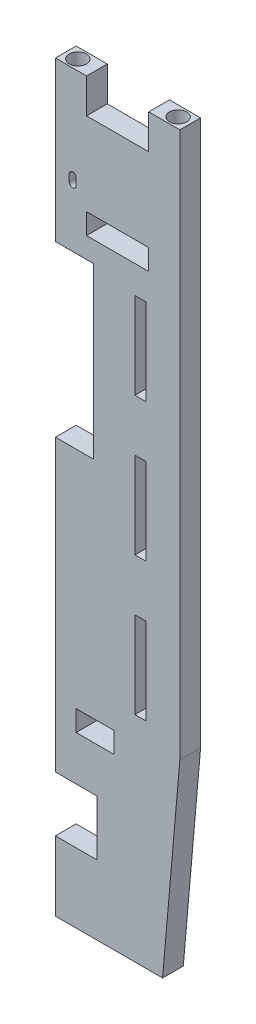
from build123d import *

# Parameters (mm, degrees)
ESQUISSE1_W                = 36
ESQUISSE1_H                = 215
BOSS_EXTRU_1_DEPTH         = 6
ESQUISSE2_W                = 18
ESQUISSE2_H                = 6
ENL_V_MAT_EXTRU_1_DEPTH    = 10
ESQUISSE3_W                = 18
ESQUISSE3_H                = 6
ENL_V_MAT_EXTRU_2_DEPTH    = 219.075674939
ESQUISSE4_W                = 11
ESQUISSE4_H                = 49
ENL_V_MAT_EXTRU_3_DEPTH    = 219.075674939
ESQUISSE5_R                = 2.5
ENL_V_MAT_EXTRU_4_DEPTH    = 10
R_P_TITION_LIN_AIRE1_COUNT = 2
R_P_TITION_LIN_AIRE1_PITCH = 29
ENL_V_MAT_EXTRU_5_DEPTH    = 10
ESQUISSE8_W                = 11
ESQUISSE8_H                = 6
ESQUISSE8_W_2              = 12
ESQUISSE8_H_2              = 16
ENL_V_MAT_EXTRU_6_DEPTH    = 219.075674939
ESQUISSE9_W                = 3.2
ESQUISSE9_H                = 25
ENL_V_MAT_EXTRU_8_DEPTH    = 219.075674939
CHANFREIN1_SIZE            = 5
CHANFREIN1_SIZE2           = 57.150261514


with BuildPart() as part:
    # Esquisse1 → Boss.-Extru.1 (new body)
    with BuildSketch(Plane.XY):
        with Locations((18, 107.5)):
            Rectangle(ESQUISSE1_W, ESQUISSE1_H)
    extrude(amount=BOSS_EXTRU_1_DEPTH)

    # Esquisse2 → Enlèv. mat.-Extru.1 (cut)
    with BuildSketch(Plane(origin=(0, 215, 0), x_dir=(1, 0, 0), z_dir=(0, 1, 0))):
        with Locations((18, -3)):
            Rectangle(ESQUISSE2_W, ESQUISSE2_H)
    extrude(amount=-ENL_V_MAT_EXTRU_1_DEPTH, mode=Mode.SUBTRACT)

    # Esquisse3 → Enlèv. mat.-Extru.2 (cut, through all)
    with BuildSketch(Plane.XY.offset(6)):
        with Locations((18, 178)):
            Rectangle(ESQUISSE3_W, ESQUISSE3_H)
    extrude(amount=-ENL_V_MAT_EXTRU_2_DEPTH, mode=Mode.SUBTRACT)

    # Esquisse4 → Enlèv. mat.-Extru.3 (cut, through all)
    with BuildSketch(Plane(origin=(0, 0, 0), x_dir=(-1, 0, 0), z_dir=(0, 0, -1))):
        with Locations((-5.5, 144.5)):
            Rectangle(ESQUISSE4_W, ESQUISSE4_H)
    extrude(amount=-ENL_V_MAT_EXTRU_3_DEPTH, mode=Mode.SUBTRACT)

    # Esquisse5 → Enlèv. mat.-Extru.4 (cut)
    with BuildSketch(Plane(origin=(0, 215, 0), x_dir=(1, 0, 0), z_dir=(0, 1, 0))):
        with Locations((3.5, -3)):
            Circle(ESQUISSE5_R)
    enl_v_mat_extru_4 = extrude(amount=-ENL_V_MAT_EXTRU_4_DEPTH, mode=Mode.SUBTRACT)

    # Répétition linéaire1: Enlèv. mat.-Extru.4 ×2
    with Locations(*[(i * R_P_TITION_LIN_AIRE1_PITCH, 0, 0) for i in range(1, R_P_TITION_LIN_AIRE1_COUNT)]):
        add(enl_v_mat_extru_4, mode=Mode.SUBTRACT)

    # Esquisse6 → Enlèv. mat.-Extru.5 (cut)
    with BuildSketch(Plane(origin=(0, 0, 0), x_dir=(-1, 0, 0), z_dir=(0, 0, -1))):
        with BuildLine():
            Line((-6.001120755, 185.973254415), (-6.001120755, 187.973254415))
            ThreePointArc((-6.001120755, 187.973254415), (-5.001120755, 188.973254415), (-4.001120755, 187.973254415))
            Line((-4.001120755, 187.973254415), (-4.001120755, 185.973254415))
            ThreePointArc((-4.001120755, 185.973254415), (-5.001120755, 184.973254415), (-6.001120755, 185.973254415))
        make_face()
    extrude(amount=-ENL_V_MAT_EXTRU_5_DEPTH, mode=Mode.SUBTRACT)

    # Esquisse8 → Enlèv. mat.-Extru.6 (cut, through all)
    with BuildSketch(Plane(origin=(0, 0, 0), x_dir=(-1, 0, 0), z_dir=(0, 0, -1))):
        with Locations((-11.5, 52)):
            Rectangle(ESQUISSE8_W, ESQUISSE8_H)
        with Locations((-6, 28.112210347)):
            Rectangle(ESQUISSE8_W_2, ESQUISSE8_H_2)
    extrude(amount=-ENL_V_MAT_EXTRU_6_DEPTH, mode=Mode.SUBTRACT)

    # Esquisse9 → Enlèv. mat.-Extru.8 (cut, through all)
    with BuildSketch(Plane.XY):
        with Locations((24.6, 74.499999718)):
            Rectangle(ESQUISSE9_W, ESQUISSE9_H)
        with Locations((24.6, 114.499999718)):
            Rectangle(ESQUISSE9_W, ESQUISSE9_H)
        with Locations((24.6, 154.499999718)):
            Rectangle(ESQUISSE9_W, ESQUISSE9_H)
    extrude(amount=ENL_V_MAT_EXTRU_8_DEPTH, mode=Mode.SUBTRACT)

    # Chanfrein1
    chanfrein1_edges = [part.edges().sort_by_distance(p)[0] for p in [
        (36, 0, 3),
    ]]
    chanfrein1_side = [part.faces().sort_by_distance(p)[0] for p in [
        (18, 0, 3),
    ]]
    chamfer(chanfrein1_edges, length=CHANFREIN1_SIZE, length2=CHANFREIN1_SIZE2, reference=chanfrein1_side[0])


solid = part.part
